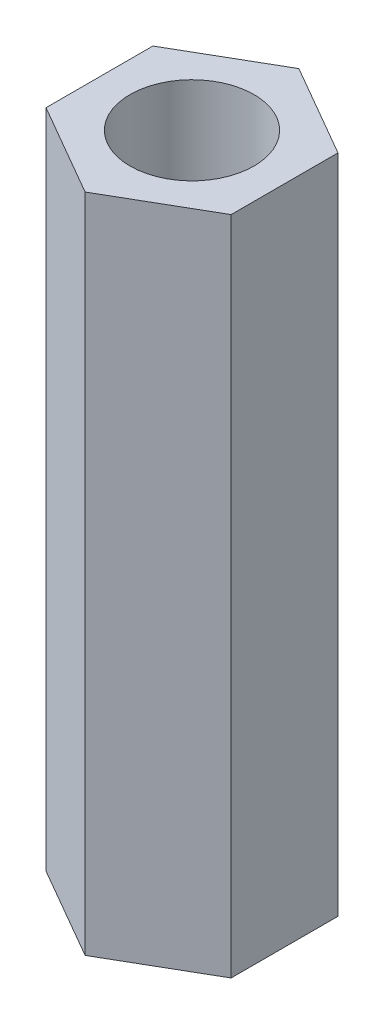
from build123d import *

# Parameters (mm, degrees)
SKETCH1_R           = 1.190625
BOSS_EXTRUDE1_DEPTH = 12.7


with BuildPart() as part:
    # Sketch1 → Boss-Extrude1 (new body)
    with BuildSketch(Plane(origin=(0, 0, 0), x_dir=(1, 0, 0), z_dir=(0, 1, 0))):
        Polygon((0, -2.053057557), (1.778, -1.026528779), (1.778, 1.026528779), (0, 2.053057557), (-1.778, 1.026528779), (-1.778, -1.026528779), align=None)
        Circle(SKETCH1_R, mode=Mode.SUBTRACT)
    extrude(amount=BOSS_EXTRUDE1_DEPTH)


solid = part.part
